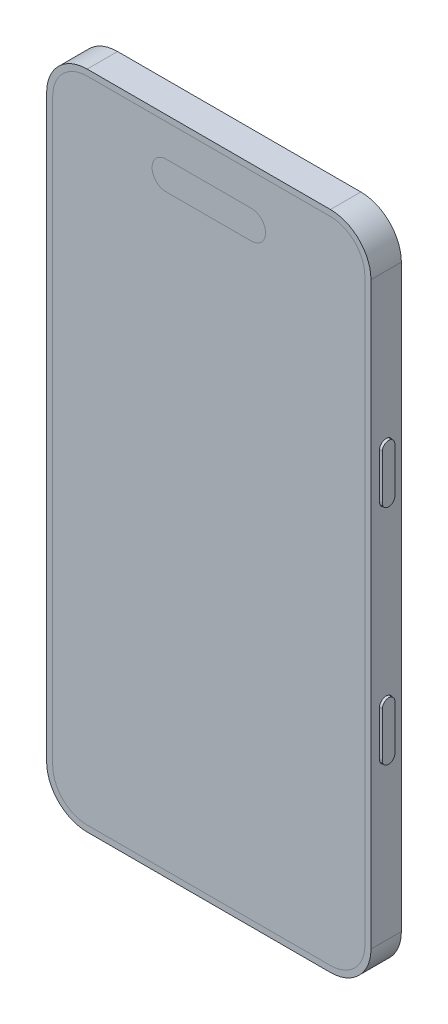
from build123d import *

# Parameters (mm, degrees)
EXTRUDE_1_DEPTH     = 7.5
EXTRUDE_2_DEPTH     = 1.2
SKETCH_6_3_R        = 7.5
EXTRUDE_3_DEPTH     = 4
SKETCH_6_4_R        = 2
EXTRUDE_4_DEPTH     = 2
CUT_EXTRUDE_2_DEPTH = 0.6
EXTRUDE_7_DEPTH     = 0.6
CUT_EXTRUDE_3_DEPTH = 0.6
EXTRUDE_8_DEPTH     = 0.6
CUT_EXTRUDE_4_DEPTH = 0.6
EXTRUDE_9_DEPTH     = 0.6
SKETCH_21_R         = 0.75
SKETCH_21_R_2       = 0.65
CUT_EXTRUDE_5_DEPTH = 3.2


with BuildPart() as part:
    # 草图1 → 凸台-拉伸1 (new body)
    with BuildSketch(Plane.XY):
        with BuildLine():
            Line((-30, -81.5), (30, -81.5))
            ThreePointArc((30, -81.5), (37.071067812, -78.571067812), (40, -71.5))
            Line((40, -71.5), (40, 71.5))
            ThreePointArc((40, 71.5), (37.071067812, 78.571067812), (30, 81.5))
            Line((30, 81.5), (-30, 81.5))
            ThreePointArc((-30, 81.5), (-37.071067812, 78.571067812), (-40, 71.5))
            Line((-40, 71.5), (-40, -71.5))
            ThreePointArc((-40, -71.5), (-37.071067812, -78.571067812), (-30, -81.5))
        make_face()
    extrude(amount=EXTRUDE_1_DEPTH)

    # 草图6 → 凸台-拉伸2 (add)
    with BuildSketch(Plane(origin=(0, 0, 0), x_dir=(-1, 0, 0), z_dir=(0, 0, -1))):
        with BuildLine():
            Line((-29, 38.5), (-7, 38.5))
            ThreePointArc((-7, 38.5), (-1.343145751, 40.843145751), (1, 46.5))
            Line((1, 46.5), (1, 68.5))
            ThreePointArc((1, 68.5), (-1.343145751, 74.156854249), (-7, 76.5))
            Line((-7, 76.5), (-29, 76.5))
            ThreePointArc((-29, 76.5), (-34.656854249, 74.156854249), (-37, 68.5))
            Line((-37, 68.5), (-37, 46.5))
            ThreePointArc((-37, 46.5), (-34.656854249, 40.843145751), (-29, 38.5))
        make_face()
    extrude(amount=EXTRUDE_2_DEPTH)

    # 草图6<3> → 凸台-拉伸3 (add)
    with BuildSketch(Plane(origin=(0, 0, 0), x_dir=(-1, 0, 0), z_dir=(0, 0, -1))):
        with Locations((-25.794228634, 66.5)):
            Circle(SKETCH_6_3_R)
        with Locations((-10.205771366, 57.5)):
            Circle(SKETCH_6_3_R)
        with Locations((-25.794228634, 48.5)):
            Circle(SKETCH_6_3_R)
    extrude(amount=EXTRUDE_3_DEPTH)

    # 草图6<4> → 凸台-拉伸4 (add)
    with BuildSketch(Plane(origin=(0, 0, 0), x_dir=(-1, 0, 0), z_dir=(0, 0, -1))):
        with Locations((-10.205771366, 69.5)):
            Circle(SKETCH_6_4_R)
    extrude(amount=EXTRUDE_4_DEPTH)

    # 草图14 → 切除-拉伸2 (cut, symmetric)
    with BuildSketch(Plane.ZY.offset(40)):
        with BuildLine():
            Line((3.225, 53.36), (4.275, 53.36))
            ThreePointArc((4.275, 53.36), (4.734619408, 53.169619408), (4.925, 52.71))
            Line((4.925, 52.71), (4.925, 48.01))
            ThreePointArc((4.925, 48.01), (4.734619408, 47.550380592), (4.275, 47.36))
            Line((4.275, 47.36), (3.225, 47.36))
            ThreePointArc((3.225, 47.36), (2.765380592, 47.550380592), (2.575, 48.01))
            Line((2.575, 48.01), (2.575, 52.71))
            ThreePointArc((2.575, 52.71), (2.765380592, 53.169619408), (3.225, 53.36))
        make_face()
    extrude(amount=CUT_EXTRUDE_2_DEPTH, both=True, mode=Mode.SUBTRACT)

    # 草图15 → 凸台-拉伸7 (add, symmetric)
    with BuildSketch(Plane.ZY.offset(40)):
        with BuildLine():
            Line((4.825, 52.71), (4.825, 48.01))
            ThreePointArc((4.825, 48.01), (4.66390873, 47.62109127), (4.275, 47.46))
            ThreePointArc((4.275, 47.46), (3.88609127, 47.62109127), (3.725, 48.01))
            Line((3.725, 48.01), (3.725, 52.71))
            ThreePointArc((3.725, 52.71), (3.88609127, 53.09890873), (4.275, 53.26))
            ThreePointArc((4.275, 53.26), (4.66390873, 53.09890873), (4.825, 52.71))
        make_face()
    extrude(amount=EXTRUDE_7_DEPTH, both=True)

    # 草图16 → 切除-拉伸3 (cut)
    with BuildSketch(Plane.ZY.offset(40)):
        with BuildLine():
            Line((5.38, 35.77), (5.38, 27.23))
            ThreePointArc((5.38, 27.23), (3.75, 25.6), (2.12, 27.23))
            Line((2.12, 27.23), (2.12, 35.77))
            ThreePointArc((2.12, 35.77), (3.75, 37.4), (5.38, 35.77))
        make_face()
        with BuildLine():
            Line((5.38, 20.77), (5.38, 12.23))
            ThreePointArc((5.38, 12.23), (3.75, 10.6), (2.12, 12.23))
            Line((2.12, 12.23), (2.12, 20.77))
            ThreePointArc((2.12, 20.77), (3.75, 22.4), (5.38, 20.77))
        make_face()
    extrude(amount=-CUT_EXTRUDE_3_DEPTH, mode=Mode.SUBTRACT)

    # 草图17 → 凸台-拉伸8 (add, symmetric)
    with BuildSketch(Plane.ZY.offset(40)):
        with BuildLine():
            Line((2.22, 35.77), (2.22, 27.23))
            ThreePointArc((2.22, 27.23), (3.75, 25.7), (5.28, 27.23))
            Line((5.28, 27.23), (5.28, 35.77))
            ThreePointArc((5.28, 35.77), (3.75, 37.3), (2.22, 35.77))
        make_face()
        with BuildLine():
            Line((2.22, 20.77), (2.22, 12.23))
            ThreePointArc((2.22, 12.23), (3.75, 10.7), (5.28, 12.23))
            Line((5.28, 12.23), (5.28, 20.77))
            ThreePointArc((5.28, 20.77), (3.75, 22.3), (2.22, 20.77))
        make_face()
    extrude(amount=EXTRUDE_8_DEPTH, both=True)

    # 草图18 → 切除-拉伸4 (cut)
    with BuildSketch(Plane(origin=(40, 0, 0), x_dir=(0, 0, -1), z_dir=(1, 0, 0))):
        with BuildLine():
            Line((-2.1, 34.05), (-2.1, 22.95))
            ThreePointArc((-2.1, 22.95), (-3.75, 21.3), (-5.4, 22.95))
            Line((-5.4, 22.95), (-5.4, 34.05))
            ThreePointArc((-5.4, 34.05), (-3.75, 35.7), (-2.1, 34.05))
        make_face()
        with BuildLine():
            Line((-2.1, -20.95), (-2.1, -32.05))
            ThreePointArc((-2.1, -32.05), (-3.75, -33.7), (-5.4, -32.05))
            Line((-5.4, -32.05), (-5.4, -20.95))
            ThreePointArc((-5.4, -20.95), (-3.75, -19.3), (-2.1, -20.95))
        make_face()
    extrude(amount=-CUT_EXTRUDE_4_DEPTH, mode=Mode.SUBTRACT)

    # 草图19 → 凸台-拉伸9 (add, symmetric)
    with BuildSketch(Plane(origin=(40, 0, 0), x_dir=(0, 0, -1), z_dir=(1, 0, 0))):
        with BuildLine():
            Line((-5.3, 34.05), (-5.3, 22.95))
            ThreePointArc((-5.3, 22.95), (-3.75, 21.4), (-2.2, 22.95))
            Line((-2.2, 22.95), (-2.2, 34.05))
            ThreePointArc((-2.2, 34.05), (-3.75, 35.6), (-5.3, 34.05))
        make_face()
        with BuildLine():
            Line((-5.3, -20.95), (-5.3, -32.05))
            ThreePointArc((-5.3, -32.05), (-3.75, -33.6), (-2.2, -32.05))
            Line((-2.2, -32.05), (-2.2, -20.95))
            ThreePointArc((-2.2, -20.95), (-3.75, -19.4), (-5.3, -20.95))
        make_face()
    extrude(amount=EXTRUDE_9_DEPTH, both=True)

    # 草图21 → 切除-拉伸5 (cut)
    with BuildSketch(Plane.XZ.offset(81.5)):
        with Locations((21, 3.75)):
            Circle(SKETCH_21_R)
        with Locations((18.5, 3.75)):
            Circle(SKETCH_21_R)
        with Locations((16, 3.75)):
            Circle(SKETCH_21_R)
        with Locations((13.5, 3.75)):
            Circle(SKETCH_21_R)
        with Locations((11, 3.75)):
            Circle(SKETCH_21_R)
        with Locations((-16, 3.75)):
            Circle(SKETCH_21_R)
        with Locations((-13.5, 3.75)):
            Circle(SKETCH_21_R)
        with Locations((-11, 3.75)):
            Circle(SKETCH_21_R)
        with Locations((-8, 3.75)):
            Circle(SKETCH_21_R_2)
        with Locations((8, 3.75)):
            Circle(SKETCH_21_R_2)
        with BuildLine():
            Line((-4.5, 5.25), (4.5, 5.25))
            ThreePointArc((4.5, 5.25), (6, 3.75), (4.5, 2.25))
            Line((4.5, 2.25), (-4.5, 2.25))
            ThreePointArc((-4.5, 2.25), (-6, 3.75), (-4.5, 5.25))
        make_face()
    extrude(amount=-CUT_EXTRUDE_5_DEPTH, mode=Mode.SUBTRACT)


solid = part.part
